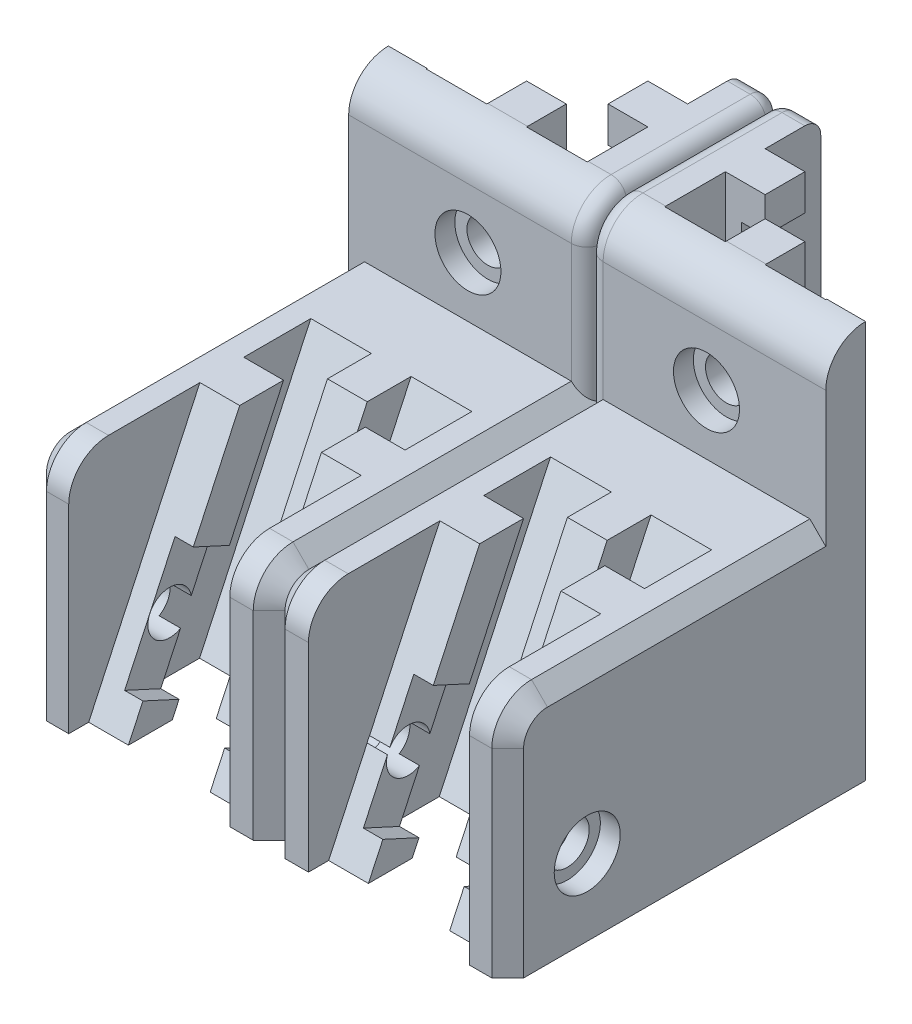
from build123d import *

# Parameters (mm, degrees)
Z_EXTRUSION_MOUNT_W     = 30
Z_EXTRUSION_MOUNT_H     = 30
BOSS_EXTRUDE1_DEPTH     = 50
CUT_EXTRUDE1_DEPTH      = 50
SKETCH3_W               = 30
SKETCH3_H               = 5.505679799
CUT_EXTRUDE3_DEPTH      = 50
SKETCH4_W               = 30
SKETCH4_H               = 30
BOSS_EXTRUDE3_DEPTH     = 40
CUT_EXTRUDE4_DEPTH      = 10
CUT_EXTRUDE4_DEPTH_BACK = 62.479626952
FILLET1_R               = 5
FILLET2_R               = 5
SKETCH11_R              = 2.75
CUT_EXTRUDE14_DEPTH     = 30
SKETCH22_R              = 4.15
CUT_EXTRUDE17_DEPTH     = 2.5
CUT_EXTRUDE18_START     = -2.5
SKETCH23_R              = 4.15
CUT_EXTRUDE18_DEPTH     = 2.5
FILLET4_R               = 2
SKETCH24_W              = 4.875
SKETCH24_H              = 19.494320201
CUT_EXTRUDE19_DEPTH     = 76.828754441
SKETCH25_R              = 2.625
CUT_EXTRUDE20_DEPTH     = 81.156097709
SKETCH26_R              = 4.15
CUT_EXTRUDE21_DEPTH     = 2.5
SKETCH27_R              = 2.625
CUT_EXTRUDE23_DEPTH     = 66.76473219
SKETCH28_R              = 4.15
CUT_EXTRUDE24_DEPTH     = 2.5
SKETCH29_W              = 10
SKETCH29_H              = 15
CUT_EXTRUDE25_DEPTH     = 3
SKETCH31_W              = 10
SKETCH31_H              = 15
CUT_EXTRUDE27_DEPTH     = 3
SKETCH33_W              = 20.25
SKETCH33_H              = 10.783419854
CUT_EXTRUDE29_DEPTH     = 62.479626952
CUT_EXTRUDE30_DEPTH     = 7.5
CHAMFER1_SIZE           = 2
FILLET5_R               = 2


with BuildPart() as part:
    # Z extrusion mount → Boss-Extrude1 (new body)
    with BuildSketch(Plane(origin=(0, 0, 0), x_dir=(1, 0, 0), z_dir=(0, 1, 0))):
        Rectangle(Z_EXTRUSION_MOUNT_W, Z_EXTRUSION_MOUNT_H)
    extrude(amount=BOSS_EXTRUDE1_DEPTH)

    # Sketch2 → Cut-Extrude1 (cut)
    with BuildSketch(Plane(origin=(0, 50, 0), x_dir=(1, 0, 0), z_dir=(0, 1, 0))):
        Polygon((-10.125, 10.125), (-10.125, -10.125), (-2.5, -10.125), (-2.5, -5.125), (2.5, -5.125), (2.5, -10.125), (10.125, -10.125), (10.125, -2.5), (5.125, -2.5), (5.125, 2.5), (10.125, 2.5), (10.125, 10.125), align=None)
    extrude(amount=-CUT_EXTRUDE1_DEPTH, mode=Mode.SUBTRACT)

    # Sketch3 → Cut-Extrude3 (cut)
    with BuildSketch(Plane(origin=(0, 50, 0), x_dir=(1, 0, 0), z_dir=(0, 1, 0))):
        with Locations((0, 12.247160101)):
            Rectangle(SKETCH3_W, SKETCH3_H)
    extrude(amount=-CUT_EXTRUDE3_DEPTH, mode=Mode.SUBTRACT)

    # Sketch4 → Boss-Extrude3 (add)
    with BuildSketch(Plane.XY.offset(15)):
        with Locations((0, 15)):
            Rectangle(SKETCH4_W, SKETCH4_H)
    extrude(amount=BOSS_EXTRUDE3_DEPTH)

    # Sketch12 → Cut-Extrude4 (cut, two sides: drawn at the far end of the back side and taken through both)
    with BuildSketch(Plane(origin=(-15, 30, 35), x_dir=(-1, 0, 0), z_dir=(0, 0.9063077870366478, -0.42261826174070405)).offset(-CUT_EXTRUDE4_DEPTH_BACK)):
        Polygon((-25.051676804, -1.850953689), (-25.051676804, -9.461830913), (-17.412554028, -9.461830913), (-17.412554028, -4.461830913), (-12.412554028, -4.461830913), (-12.412554028, -9.461830913), (-4.801676804, -9.461830913), (-4.801676804, -1.822708137), (-9.801676804, -1.822708137), (-9.801676804, 3.177291863), (-4.801676804, 3.177291863), (-4.801676804, 10.788169087), (-12.440799581, 10.788169087), (-12.440799581, 5.788169087), (-17.440799581, 5.788169087), (-17.440799581, 10.788169087), (-25.051676804, 10.788169087), (-25.051676804, 3.149046311), (-20.051676804, 3.149046311), (-20.051676804, -1.850953689), align=None)
    extrude(amount=CUT_EXTRUDE4_DEPTH + CUT_EXTRUDE4_DEPTH_BACK, mode=Mode.SUBTRACT)

    # Fillet1
    fillet1_edges = [part.edges().sort_by_distance(p)[0] for p in [
        (0, 30, 55),
    ]]
    fillet(fillet1_edges, radius=FILLET1_R)

    # Fillet2
    # the kernel refuses this fillet: 5 mm, written as the material it takes off along each edge
    with BuildSketch(Plane(origin=(-27.5, 50, 15), x_dir=(0, -1, 0), z_dir=(1, 0, 0))) as fillet2_piece_1:
        with BuildLine():
            CenterArc((FILLET2_R, FILLET2_R), FILLET2_R, 180, 90)
            Line((0, FILLET2_R), (0, 0))
            Line((0, 0), (FILLET2_R, 0))
        make_face()
    extrude(amount=55, mode=Mode.SUBTRACT)

    # Sketch11 → Cut-Extrude14 (cut)
    with BuildSketch(Plane.ZY.offset(15)):
        with Locations((45, 9.554930795)):
            Circle(SKETCH11_R)
    extrude(amount=-CUT_EXTRUDE14_DEPTH, mode=Mode.SUBTRACT)

    # Sketch22 → Cut-Extrude17 (cut)
    with BuildSketch(Plane(origin=(15, 0, 0), x_dir=(0, 0, -1), z_dir=(1, 0, 0))):
        with Locations((-45, 9.554930795)):
            Circle(SKETCH22_R)
    extrude(amount=-CUT_EXTRUDE17_DEPTH, mode=Mode.SUBTRACT)

    # Sketch23 → Cut-Extrude18 (cut)
    with BuildSketch(Plane.ZY.offset(15).offset(CUT_EXTRUDE18_START)):
        with Locations(Location((45, 9.554930795, 0), (0, 0, 180))):
            Circle(SKETCH23_R)
    extrude(amount=CUT_EXTRUDE18_DEPTH, mode=Mode.SUBTRACT)

    # Fillet4
    fillet4_edges = [part.edges().sort_by_distance(p)[0] for p in [
        (15, 50, 0.252839899),
        (15, 48.535533906, 13.535533906),
        (15, 37.5, 15),
    ]]
    fillet(fillet4_edges, radius=FILLET4_R)

    # Sketch24 → Cut-Extrude19 (cut, through all)
    with BuildSketch(Plane(origin=(0, 50, 0), x_dir=(1, 0, 0), z_dir=(0, 1, 0))):
        with Locations((-12.5625, -0.252839899)):
            Rectangle(SKETCH24_W, SKETCH24_H)
    extrude(amount=-CUT_EXTRUDE19_DEPTH, mode=Mode.SUBTRACT)

    # Sketch25 → Cut-Extrude20 (cut, through all)
    with BuildSketch(Plane(origin=(15, 0, 0), x_dir=(0, 0, -1), z_dir=(1, 0, 0))):
        with Locations((-0.005679799, 38)):
            Circle(SKETCH25_R)
        with Locations((-0.005679799, 10)):
            Circle(SKETCH25_R)
    extrude(amount=-CUT_EXTRUDE20_DEPTH, mode=Mode.SUBTRACT)

    # Sketch26 → Cut-Extrude21 (cut)
    with BuildSketch(Plane(origin=(15, 0, 0), x_dir=(0, 0, -1), z_dir=(1, 0, 0))):
        with Locations((-0.005679799, 38)):
            Circle(SKETCH26_R)
        with Locations((-0.005679799, 10)):
            Circle(SKETCH26_R)
    extrude(amount=-CUT_EXTRUDE21_DEPTH, mode=Mode.SUBTRACT)

    # Sketch27 → Cut-Extrude23 (cut, through all)
    with BuildSketch(Plane.XY.offset(15)):
        with Locations((0, 37.5)):
            Circle(SKETCH27_R)
    extrude(amount=-CUT_EXTRUDE23_DEPTH, mode=Mode.SUBTRACT)

    # Sketch28 → Cut-Extrude24 (cut)
    with BuildSketch(Plane.XY.offset(15)):
        with Locations((0, 37.5)):
            Circle(SKETCH28_R)
    extrude(amount=-CUT_EXTRUDE24_DEPTH, mode=Mode.SUBTRACT)

    # Sketch29 → Cut-Extrude25 (cut)
    with BuildSketch(Plane(origin=(0, 0, 5.125), x_dir=(-1, 0, 0), z_dir=(0, 0, -1))):
        with Locations((0, 37.5)):
            Rectangle(SKETCH29_W, SKETCH29_H)
    extrude(amount=-CUT_EXTRUDE25_DEPTH, mode=Mode.SUBTRACT)

    # Sketch31 → Cut-Extrude27 (cut)
    with BuildSketch(Plane.ZY.offset(-5.125)):
        with Locations((0.005679799, 38)):
            Rectangle(SKETCH31_W, SKETCH31_H)
        with Locations((0.005679799, 10)):
            Rectangle(SKETCH31_W, SKETCH31_H)
    extrude(amount=-CUT_EXTRUDE27_DEPTH, mode=Mode.SUBTRACT)

    # Sketch33 → Cut-Extrude29 (cut, through all)
    with BuildSketch(Plane(origin=(-15, 30, 35), x_dir=(-1, 0, 0), z_dir=(0, 0.9063077870366478, -0.42261826174070405))):
        with Locations((-14.926676804, 11.08981557)):
            Rectangle(SKETCH33_W, SKETCH33_H)
    extrude(amount=-CUT_EXTRUDE29_DEPTH, mode=Mode.SUBTRACT)

    # Sketch35 → Cut-Extrude30 (cut, symmetric)
    with BuildSketch(Plane(origin=(0, 0, 0), x_dir=(0, 0, -1), z_dir=(1, 0, 0))):
        Polygon((-37.747378495, 14.475156436), (-45.033706868, 17.825136051), (-52.252621505, 4.634705153), (-44.966293132, 1.284725539), align=None)
    extrude(amount=CUT_EXTRUDE30_DEPTH, both=True, mode=Mode.SUBTRACT)

    # Chamfer1
    chamfer1_edges = [part.edges().sort_by_distance(p)[0] for p in [
        (15, 12.5, 55),
        (15, 28.535533906, 53.535533906),
        (15, 30, 31.5),
        (-15, 12.5, 55),
        (-15, 28.535533906, 53.535533906),
        (-15, 30, 32.5),
    ]]
    chamfer(chamfer1_edges, length=CHAMFER1_SIZE)

    # Fillet5
    fillet5_edges = [part.edges().sort_by_distance(p)[0] for p in [
        (14.414213562, 49.414213562, -9.494320201),
        (15, 24, -9.494320201),
        (11.5625, 50, -9.494320201),
    ]]
    fillet(fillet5_edges, radius=FILLET5_R)


with BuildPart() as body_2:
    # Mirror1: mirrored copy
    add(part.part.mirror(Plane(origin=(15, 50, 15), x_dir=(0, 0, 1), z_dir=(-1, 0, 0))))


solid = Compound([part.part, body_2.part])
